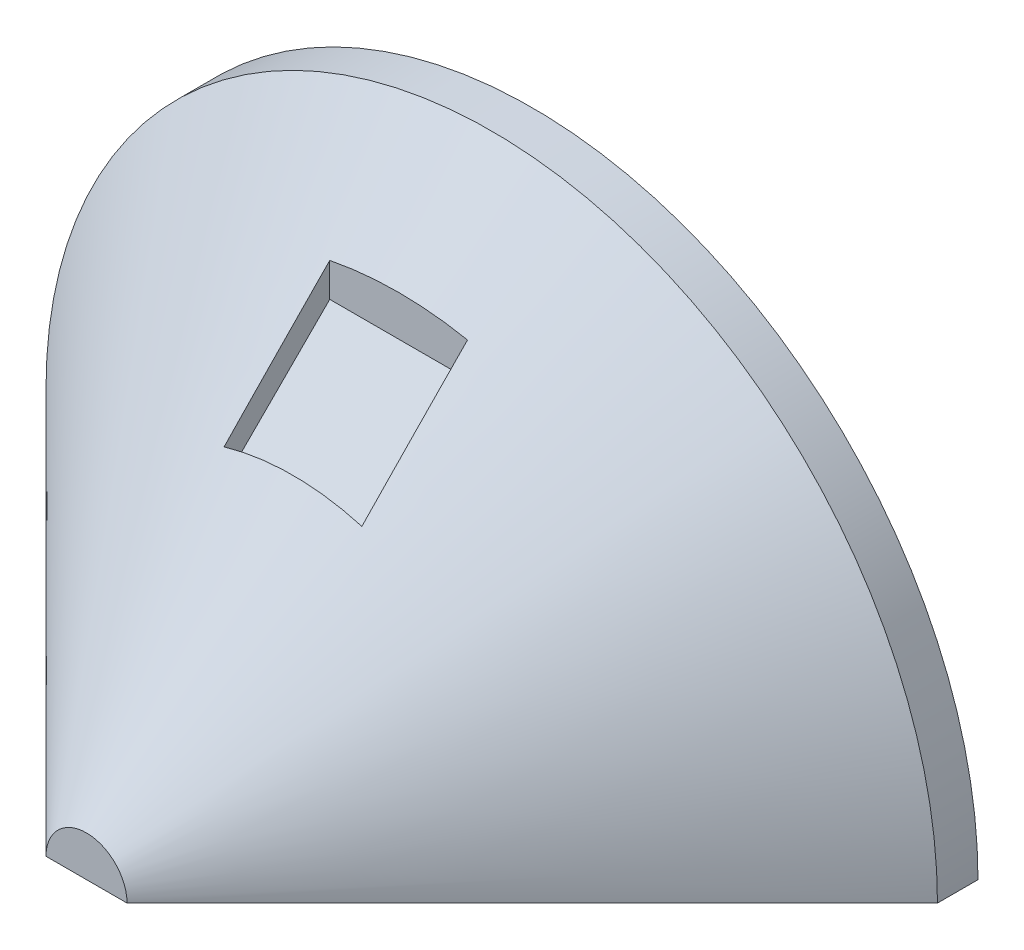
from build123d import *

# Parameters (mm, degrees)
REVOLVE2_ANGLE          = 180
CUT_EXTRUDE1_DEPTH      = 6.477
CUT_EXTRUDE1_DEPTH_BACK = 6.477


# Read off the part's stored shape, not the designer's step: Revolve2
with BuildPart() as part:
    # Revolve2 outline → Revolve2 (revolve)
    with BuildSketch(Plane.XZ):
        Polygon((3.81, 0), (0, 0), (0, -3.81), (38.1, -41.91), (41.91, -41.91), (41.91, -38.1), align=None)
    revolve(axis=Axis((0, 0, 0), (0, 0, 1)), revolution_arc=REVOLVE2_ANGLE)

    # Sketch6 → Cut-Extrude1 (cut, two sides: drawn at the far end of the back side and taken through both)
    with BuildSketch(Plane(origin=(0, 0, 0), x_dir=(0, 0, -1), z_dir=(1, 0, 0)).offset(-CUT_EXTRUDE1_DEPTH_BACK)):
        Polygon((19.412948776, 19.412948776), (19.412948776, 29.318948776), (19.412948776, 36.223650293), (29.344348776, 36.223650293), (29.344348776, 29.344348776), align=None)
    extrude(amount=CUT_EXTRUDE1_DEPTH + CUT_EXTRUDE1_DEPTH_BACK, mode=Mode.SUBTRACT)


solid = part.part
